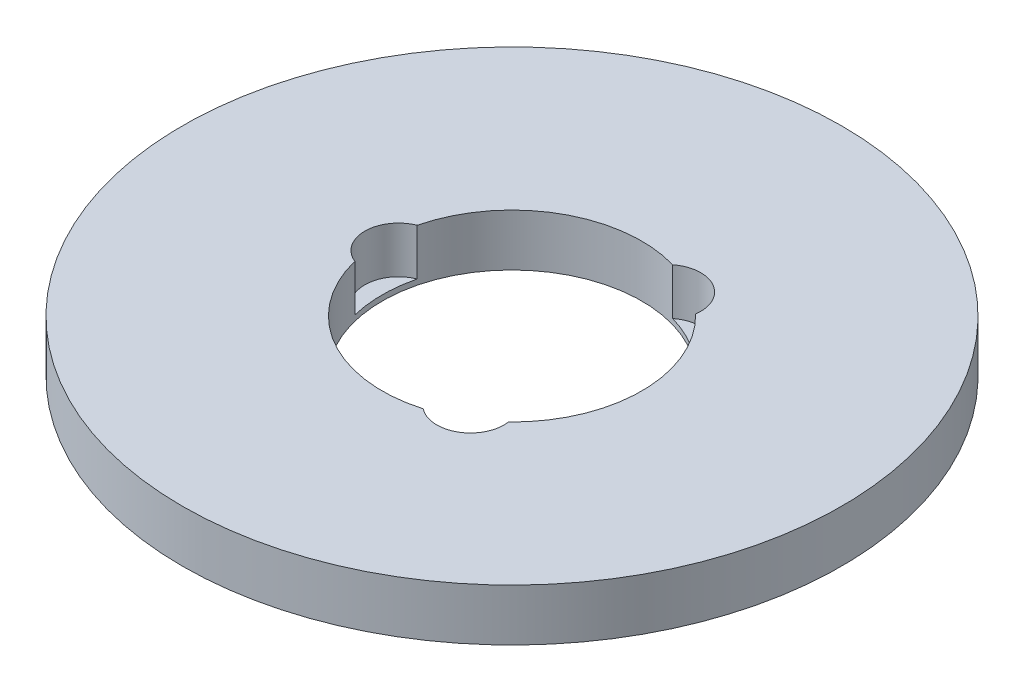
from build123d import *

# Parameters (mm, degrees)
SKETCH1_R           = 82.5
BOSS_EXTRUDE1_DEPTH = 13
SKETCH2_R           = 32.5
CUT_EXTRUDE1_DEPTH  = 118.394633608
SKETCH3_R           = 8.411835855
CUT_EXTRUDE2_DEPTH  = 11.651763118
CIRPATTERN1_COUNT   = 3


with BuildPart() as part:
    # Sketch1 → Boss-Extrude1 (new body)
    with BuildSketch(Plane(origin=(0, 0, 0), x_dir=(1, 0, 0), z_dir=(0, 1, 0))):
        Circle(SKETCH1_R)
    extrude(amount=BOSS_EXTRUDE1_DEPTH)

    # Sketch2 → Cut-Extrude1 (cut, through all)
    with BuildSketch(Plane(origin=(0, 0, 0), x_dir=(1, 0, 0), z_dir=(0, 1, 0))):
        Circle(SKETCH2_R)
    extrude(amount=CUT_EXTRUDE1_DEPTH, mode=Mode.SUBTRACT)

    # Sketch3 → Cut-Extrude2 (cut)
    with BuildSketch(Plane(origin=(0, 13, 0), x_dir=(1, 0, 0), z_dir=(0, 1, 0))):
        with Locations((-28.426465379, 0)):
            Circle(SKETCH3_R)
    cut_extrude2 = extrude(amount=-CUT_EXTRUDE2_DEPTH, mode=Mode.SUBTRACT)

    # CirPattern1: Cut-Extrude2 ×3 about axis
    cirpattern1_axis = Axis((0, 0, 0), (0, 1, 0))
    for i in range(1, CIRPATTERN1_COUNT):
        add(cut_extrude2.rotate(cirpattern1_axis, i * 360 / CIRPATTERN1_COUNT), mode=Mode.SUBTRACT)


solid = part.part
